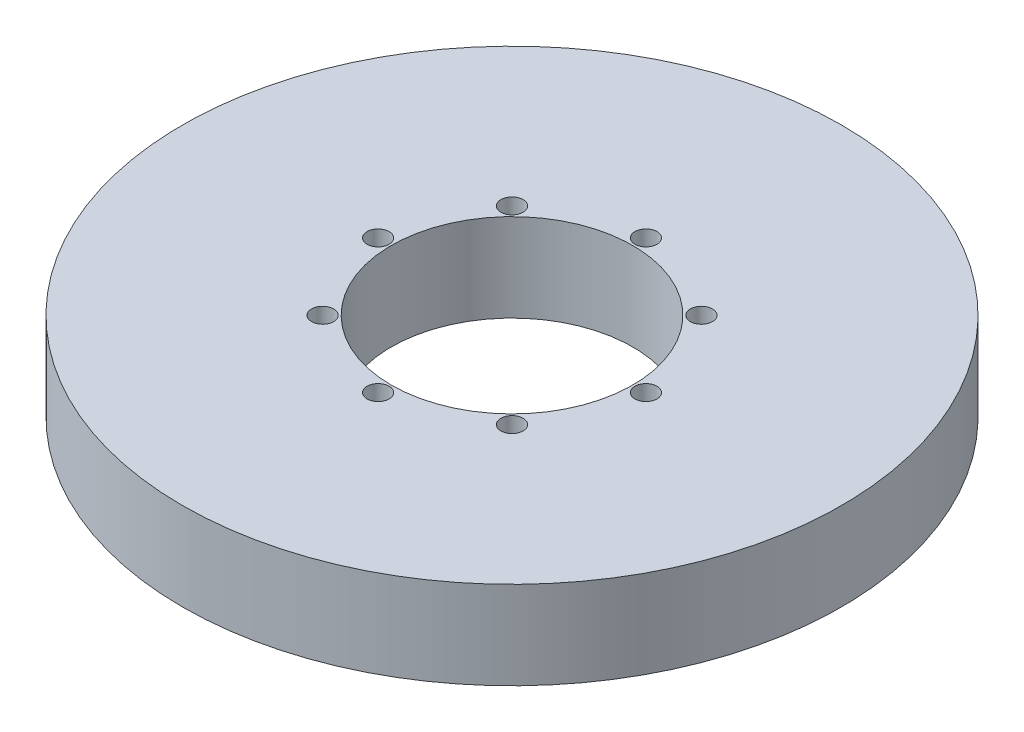
from build123d import *

# Parameters (mm, degrees)
SKETCH1_R           = 75
BOSS_EXTRUDE1_DEPTH = 20
SKETCH2_R           = 27.5
CUT_EXTRUDE1_DEPTH  = 108.935165725
SKETCH3_R           = 2.513127898
CUT_EXTRUDE2_DEPTH  = 19.937124282
CIRPATTERN1_COUNT   = 8


with BuildPart() as part:
    # Sketch1 → Boss-Extrude1 (new body)
    with BuildSketch(Plane(origin=(0, 0, 0), x_dir=(1, 0, 0), z_dir=(0, 1, 0))):
        Circle(SKETCH1_R)
    extrude(amount=BOSS_EXTRUDE1_DEPTH)

    # Sketch2 → Cut-Extrude1 (cut, through all)
    with BuildSketch(Plane(origin=(0, 0, 0), x_dir=(1, 0, 0), z_dir=(0, 1, 0))):
        Circle(SKETCH2_R)
    extrude(amount=CUT_EXTRUDE1_DEPTH, mode=Mode.SUBTRACT)

    # Sketch3 → Cut-Extrude2 (cut)
    with BuildSketch(Plane(origin=(0, 20, 0), x_dir=(1, 0, 0), z_dir=(0, 1, 0))):
        with Locations((-30.476440099, 0)):
            Circle(SKETCH3_R)
    cut_extrude2 = extrude(amount=-CUT_EXTRUDE2_DEPTH, mode=Mode.SUBTRACT)

    # CirPattern1: Cut-Extrude2 ×8 about axis
    cirpattern1_axis = Axis((0, 0, 0), (0, 1, 0))
    for i in range(1, CIRPATTERN1_COUNT):
        add(cut_extrude2.rotate(cirpattern1_axis, i * 360 / CIRPATTERN1_COUNT), mode=Mode.SUBTRACT)


solid = part.part
